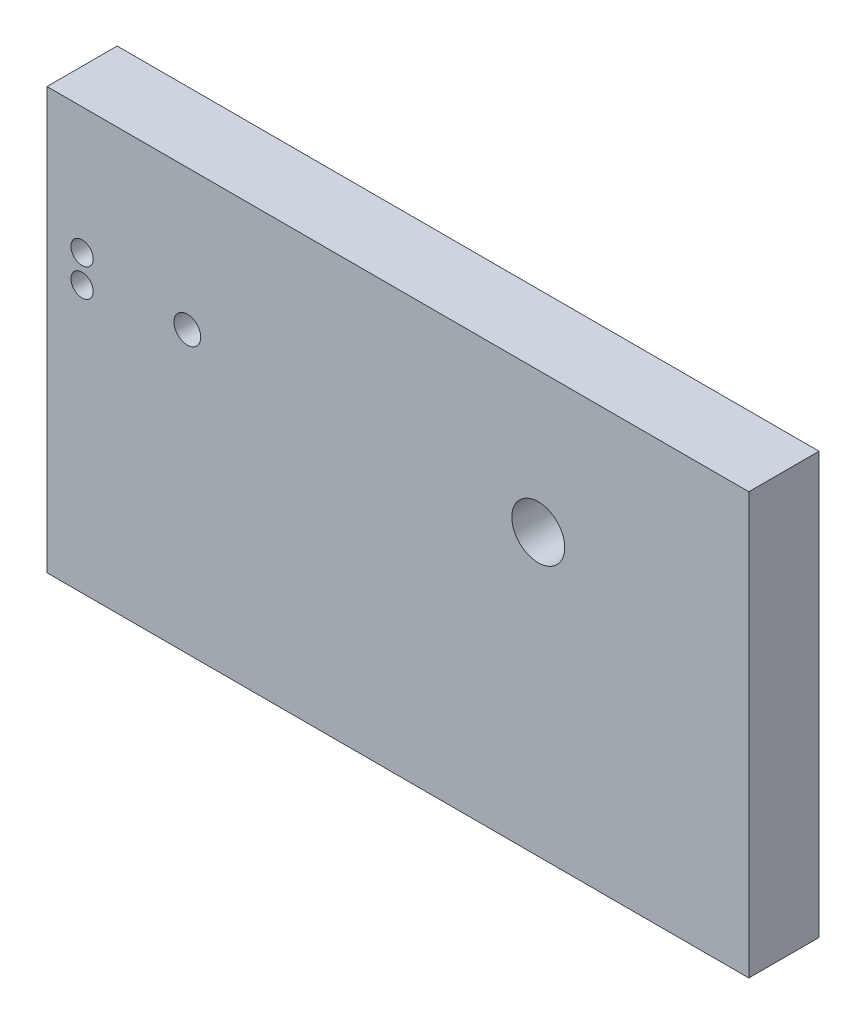
from build123d import *

# Parameters (mm, degrees)
SKETCH1_W                   = 127
SKETCH1_H                   = 76.2
BOSS_EXTRUDE1_DEPTH         = 12.7
F_11_0_191_DIAMETER_HOLE1_D = 4.8514
F_10_32_TAPPED_HOLE1_D      = 4.0386
F_10_32_TAPPED_HOLE1_DEPTH  = 12.7
F_10_32_TAPPED_HOLE1_TIP    = 1.213317848
V_0_377_DIAMETER_HOLE1_D    = 9.5758
F_10_32_TAPPED_HOLE2_D      = 4.0386
F_21_0_159_DIAMETER_HOLE1_D = 4.0386


with BuildPart() as part:
    # Sketch1 → Boss-Extrude1 (new body)
    with BuildSketch(Plane.XY):
        with Locations((63.5, 38.1)):
            Rectangle(SKETCH1_W, SKETCH1_H)
    extrude(amount=BOSS_EXTRUDE1_DEPTH)

    # #11 (0.191) Diameter Hole1 (through all)
    with Locations(Plane.XY.offset(12.7)):
        with Locations((25.4, 50.8)):
            Hole(F_11_0_191_DIAMETER_HOLE1_D / 2)

    # #10-32 Tapped Hole1
    with Locations(Plane(origin=(0, 0, 0), x_dir=(-1, 0, 0), z_dir=(0, -1, 0))):
        with Locations((-19.05, -6.35), (-107.95, -6.35)):
            Hole(F_10_32_TAPPED_HOLE1_D / 2, depth=F_10_32_TAPPED_HOLE1_DEPTH)
            with Locations((0, 0, -(F_10_32_TAPPED_HOLE1_DEPTH + F_10_32_TAPPED_HOLE1_TIP / 2))):  # 118° drill point
                Cone(0, F_10_32_TAPPED_HOLE1_D / 2, F_10_32_TAPPED_HOLE1_TIP, mode=Mode.SUBTRACT)

    # V (0.377) Diameter Hole1 (through all)
    with Locations(Plane.XY.offset(12.7)):
        with Locations((88.9, 50.8)):
            Hole(V_0_377_DIAMETER_HOLE1_D / 2)

    # #10-32 Tapped Hole2 (through all)
    with Locations(Plane.XY.offset(12.7)):
        with Locations((6.35, 48.26)):
            Hole(F_10_32_TAPPED_HOLE2_D / 2)

    # #21 (0.159) Diameter Hole1 (through all)
    with Locations(Plane.XY.offset(12.7)):
        with Locations((6.35, 53.34)):
            Hole(F_21_0_159_DIAMETER_HOLE1_D / 2)


solid = part.part
